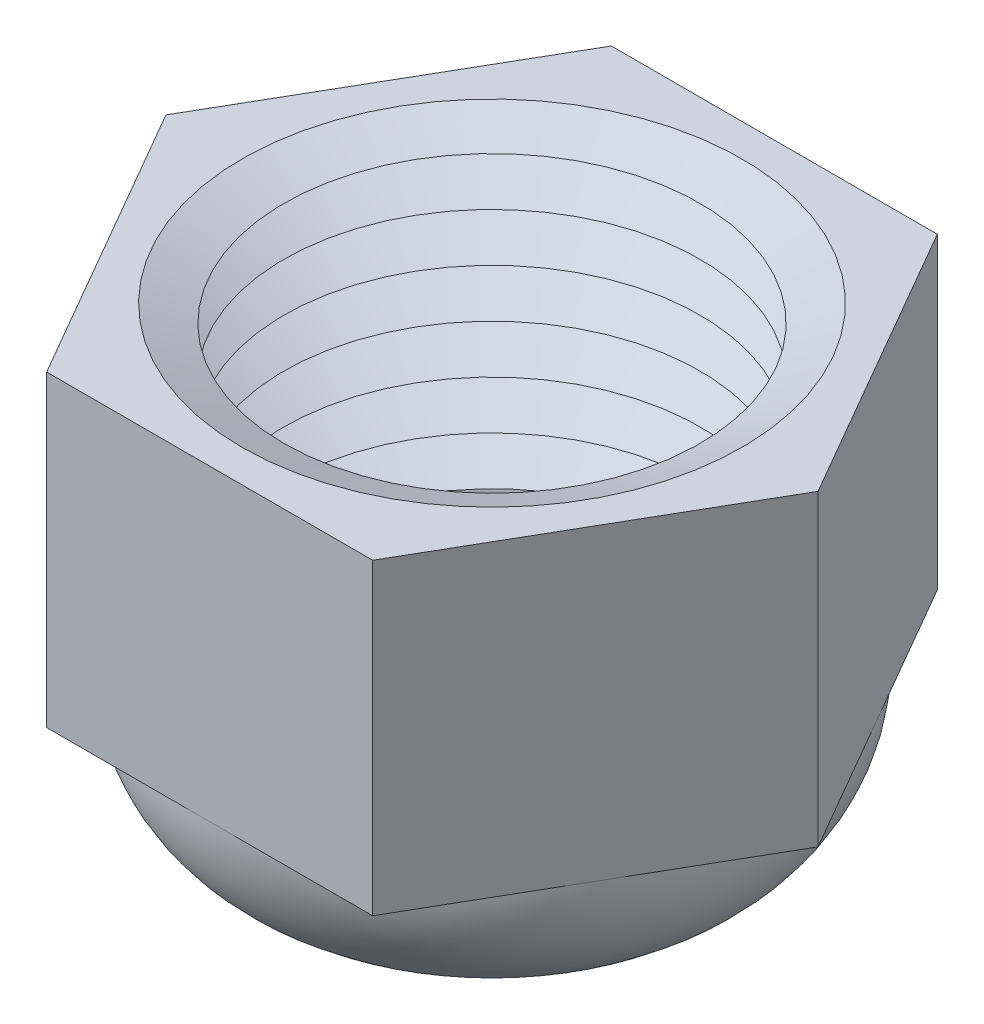
from build123d import *

# Parameters (mm, degrees)
BOSS_EXTRUDE1_DEPTH = 5.18
SKETCH3_R           = 9.5
BOSS_EXTRUDE2_DEPTH = 5
FILLET3_R           = 5
SKETCH4_R           = 6.9
CUT_EXTRUDE1_DEPTH  = 5
FILLET4_R           = 5


# Some blends are built 0.0001 mm under size
with BuildPart() as part:
    # Sketch1 → Boss-Extrude1 (new, symmetric)
    with BuildSketch(Plane(origin=(0, 0, 0), x_dir=(1, 0, 0), z_dir=(0, 1, 0))):
        Polygon((10.969655115, 0), (5.484827557, 9.5), (-5.484827557, 9.5), (-10.969655115, 0), (-5.484827557, -9.5), (5.484827557, -9.5), align=None)
    extrude(amount=BOSS_EXTRUDE1_DEPTH, both=True)

    # Sketch2 → Cut-Revolve1 (revolve, cut)
    with BuildSketch(Plane(origin=(0, 0, 0), x_dir=(0, 0, -1), z_dir=(1, 0, 0))):
        Polygon((-8.41, 5.18), (0, 5.18), (0, -5.18), (-7, -5.18), (-8.41, -4.36593612), (-7, -3.551872241), (-8.41, -2.737808361), (-7, -1.923744482), (-8.41, -1.109680602), (-7, -0.295616723), (-8.41, 0.518447157), (-7, 1.332511036), (-8.41, 2.146574916), (-7, 2.960638796), (-8.41, 3.774702675), (-7, 4.588766555), align=None)
    revolve(axis=Axis((0, 5.18, 0), (0, -1, 0)), mode=Mode.SUBTRACT)

    # Sketch3 → Boss-Extrude2 (add)
    with BuildSketch(Plane.XZ.offset(5.18)):
        with Locations(Location((0, 0, 0), (0, 0, 270))):
            Circle(SKETCH3_R)
    extrude(amount=BOSS_EXTRUDE2_DEPTH)

    # Fillet3
    fillet3_edges = [part.edges().sort_by_distance(p)[0] for p in [
        (0, -10.18, 9.5),
    ]]
    fillet(fillet3_edges, radius=FILLET3_R - 0.0001)  # a hair under: the kernel refuses the full size

    # Sketch4 → Cut-Extrude1 (cut)
    with BuildSketch(Plane.XZ.offset(10.18)):
        with Locations(Location((0, 0, 0), (0, 0, 270))):
            Circle(SKETCH4_R)
    extrude(amount=-CUT_EXTRUDE1_DEPTH, mode=Mode.SUBTRACT)

    # Fillet4
    # the kernel refuses this fillet: 5 mm, written as the material it takes off along each edge
    with BuildSketch(Plane(origin=(0, -5.18, 0), x_dir=(0, 0, -1), z_dir=(-1, 0, 0))) as fillet4_piece_1:
        with BuildLine():
            CenterArc((11.9, 0.994987437), FILLET4_R, 180, 11.478340955)
            Line((7, 0), (6.9, 0))
            Line((6.9, 0), (6.9, 0.994987437))
        make_face()
    revolve(axis=Axis((0, -5.18, 0), (0, -1, 0)), mode=Mode.SUBTRACT)


solid = part.part
